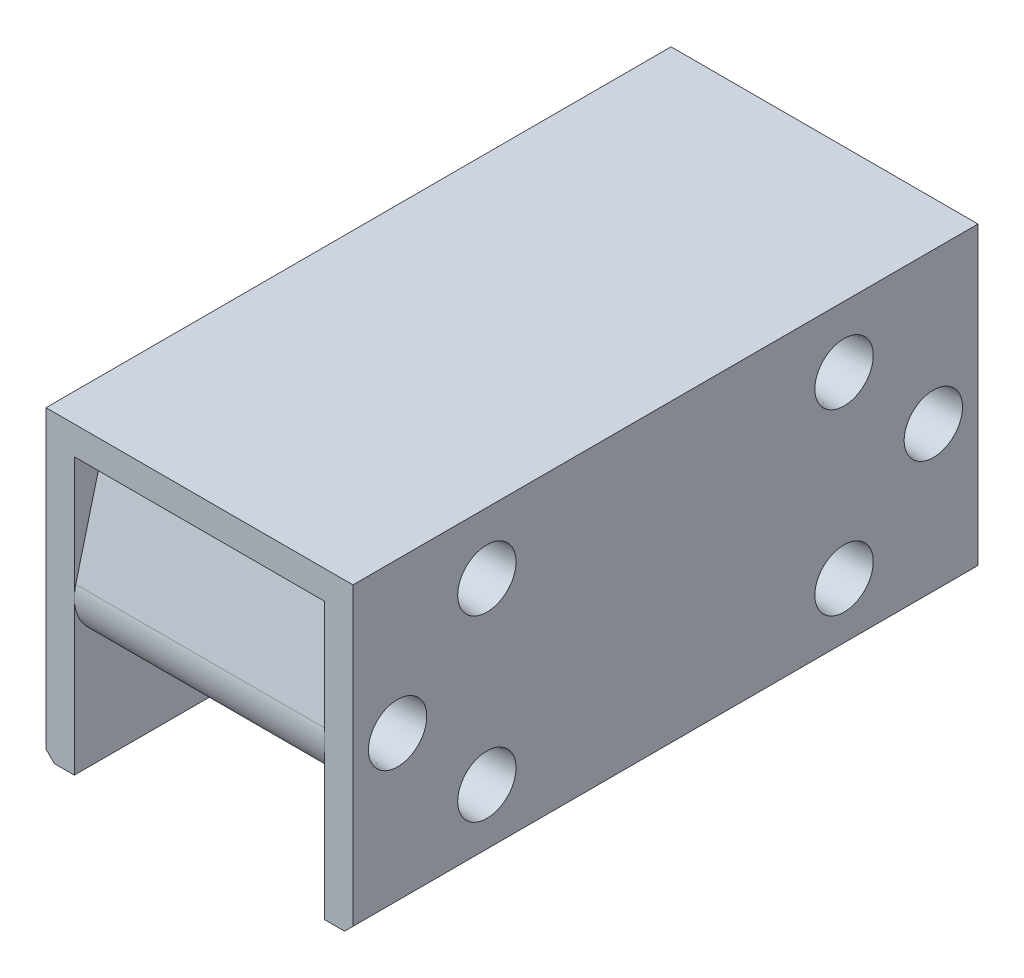
from build123d import *

# Parameters (mm, degrees)
BOSS_EXTRUDE1_DEPTH             = 12
BOSS_EXTRUDE1_DEPTH_BACK        = 44
BOSS_EXTRUDE2_REACH             = 56.729
BOSS_EXTRUDE2_DIRECTION_2_REACH = 56.729
CHAMFER1_SIZE                   = 0.75


# Read off the part's stored shape, not the designer's step: Sketch-Pattern1
with BuildPart() as part:
    # Sketch1 → Boss-Extrude1 (new, two sides: drawn at the far end of the back side and taken through both)
    with BuildSketch(Plane.XY.offset(-BOSS_EXTRUDE1_DEPTH_BACK)):
        Polygon((-13.75, 29.5), (13.75, 29.5), (13.75, 2.254), (11.21, 2.254), (11.21, 26.96), (-11.21, 26.96), (-11.21, 2.254), (-13.75, 2.254), align=None)
    extrude(amount=BOSS_EXTRUDE1_DEPTH + BOSS_EXTRUDE1_DEPTH_BACK)

    # Boss-Extrude2: up to this face of the body (flat: up to its plane)
    boss_extrude2_end = Plane(part.part.faces().sort_by_distance((13.75, 15.877, -16))[0])
    # Sketch2 → Boss-Extrude2 (add, up to the picked face)
    with BuildSketch(Plane(origin=(0, 0, 0), x_dir=(0, 0, -1), z_dir=(1, 0, 0)), mode=Mode.PRIVATE) as boss_extrude2_sk1:
        with BuildLine():
            Line((-3.872983346, 9), (-1, 20.127016654))
            ThreePointArc((-1, 20.127016654), (0, 28), (1, 20.127016654))
            Line((1, 20.127016654), (3.872983346, 9))
            ThreePointArc((3.872983346, 9), (0, 4), (-3.872983346, 9))
        make_face()
    boss_extrude2_tool1 = split(extrude(boss_extrude2_sk1.sketch, amount=BOSS_EXTRUDE2_REACH, mode=Mode.PRIVATE), bisect_by=boss_extrude2_end, keep=Keep.BOTH, mode=Mode.PRIVATE)
    # Sketch2 → Boss-Extrude2 (add, up to the picked face)
    with BuildSketch(Plane(origin=(0, 0, 0), x_dir=(0, 0, -1), z_dir=(1, 0, 0)), mode=Mode.PRIVATE) as boss_extrude2_sk2:
        with BuildLine():
            Line((-4.127016654, 17), (-6.698677596, 26.96))
            Line((-6.698677596, 26.96), (-9.301322404, 26.96))
            Line((-9.301322404, 26.96), (-11.872983346, 17))
            ThreePointArc((-11.872983346, 17), (-8, 12), (-4.127016654, 17))
        make_face()
    boss_extrude2_tool2 = split(extrude(boss_extrude2_sk2.sketch, amount=BOSS_EXTRUDE2_REACH, mode=Mode.PRIVATE), bisect_by=boss_extrude2_end, keep=Keep.BOTH, mode=Mode.PRIVATE)
    # Sketch2 → Boss-Extrude2 (add, up to the picked face)
    with BuildSketch(Plane(origin=(0, 0, 0), x_dir=(0, 0, -1), z_dir=(1, 0, 0)), mode=Mode.PRIVATE) as boss_extrude2_sk3:
        with BuildLine():
            Line((41.301322404, 26.96), (38.698677596, 26.96))
            Line((38.698677596, 26.96), (36.127016654, 17))
            ThreePointArc((36.127016654, 17), (40, 12), (43.872983346, 17))
            Line((43.872983346, 17), (41.301322404, 26.96))
        make_face()
    boss_extrude2_tool3 = split(extrude(boss_extrude2_sk3.sketch, amount=BOSS_EXTRUDE2_REACH, mode=Mode.PRIVATE), bisect_by=boss_extrude2_end, keep=Keep.BOTH, mode=Mode.PRIVATE)
    # Sketch2 → Boss-Extrude2 (add, up to the picked face)
    with BuildSketch(Plane(origin=(0, 0, 0), x_dir=(0, 0, -1), z_dir=(1, 0, 0)), mode=Mode.PRIVATE) as boss_extrude2_sk4:
        with BuildLine():
            Line((28.127016654, 9), (31, 20.127016654))
            ThreePointArc((31, 20.127016654), (32, 28), (33, 20.127016654))
            Line((33, 20.127016654), (35.872983346, 9))
            ThreePointArc((35.872983346, 9), (32, 4), (28.127016654, 9))
        make_face()
    boss_extrude2_tool4 = split(extrude(boss_extrude2_sk4.sketch, amount=BOSS_EXTRUDE2_REACH, mode=Mode.PRIVATE), bisect_by=boss_extrude2_end, keep=Keep.BOTH, mode=Mode.PRIVATE)
    add(boss_extrude2_tool1.solids().sort_by(Axis((0, 15.717101, 0), (1, 0, 0)))[0])
    add(boss_extrude2_tool2.solids().sort_by(Axis((0, 18.682958, 8), (1, 0, 0)))[0])
    add(boss_extrude2_tool3.solids().sort_by(Axis((0, 18.682958, -40), (1, 0, 0)))[0])
    add(boss_extrude2_tool4.solids().sort_by(Axis((0, 15.717101, -32), (1, 0, 0)))[0])

    # Boss-Extrude2 direction 2: up to this face of the body (flat: up to its plane)
    boss_extrude2_direction_2_end = Plane(part.part.faces().sort_by_distance((-13.75, 15.877, -16))[0])
    # Sketch2 → Boss-Extrude2 direction 2 (add, up to the picked face)
    with BuildSketch(Plane(origin=(0, 0, 0), x_dir=(0, 0, -1), z_dir=(1, 0, 0)), mode=Mode.PRIVATE) as boss_extrude2_direction_2_sk1:
        with BuildLine():
            Line((-3.872983346, 9), (-1, 20.127016654))
            ThreePointArc((-1, 20.127016654), (0, 28), (1, 20.127016654))
            Line((1, 20.127016654), (3.872983346, 9))
            ThreePointArc((3.872983346, 9), (0, 4), (-3.872983346, 9))
        make_face()
    boss_extrude2_direction_2_tool1 = split(extrude(boss_extrude2_direction_2_sk1.sketch, amount=-BOSS_EXTRUDE2_DIRECTION_2_REACH, mode=Mode.PRIVATE), bisect_by=boss_extrude2_direction_2_end, keep=Keep.BOTH, mode=Mode.PRIVATE)
    # Sketch2 → Boss-Extrude2 direction 2 (add, up to the picked face)
    with BuildSketch(Plane(origin=(0, 0, 0), x_dir=(0, 0, -1), z_dir=(1, 0, 0)), mode=Mode.PRIVATE) as boss_extrude2_direction_2_sk2:
        with BuildLine():
            Line((-4.127016654, 17), (-6.698677596, 26.96))
            Line((-6.698677596, 26.96), (-9.301322404, 26.96))
            Line((-9.301322404, 26.96), (-11.872983346, 17))
            ThreePointArc((-11.872983346, 17), (-8, 12), (-4.127016654, 17))
        make_face()
    boss_extrude2_direction_2_tool2 = split(extrude(boss_extrude2_direction_2_sk2.sketch, amount=-BOSS_EXTRUDE2_DIRECTION_2_REACH, mode=Mode.PRIVATE), bisect_by=boss_extrude2_direction_2_end, keep=Keep.BOTH, mode=Mode.PRIVATE)
    # Sketch2 → Boss-Extrude2 direction 2 (add, up to the picked face)
    with BuildSketch(Plane(origin=(0, 0, 0), x_dir=(0, 0, -1), z_dir=(1, 0, 0)), mode=Mode.PRIVATE) as boss_extrude2_direction_2_sk3:
        with BuildLine():
            Line((41.301322404, 26.96), (38.698677596, 26.96))
            Line((38.698677596, 26.96), (36.127016654, 17))
            ThreePointArc((36.127016654, 17), (40, 12), (43.872983346, 17))
            Line((43.872983346, 17), (41.301322404, 26.96))
        make_face()
    boss_extrude2_direction_2_tool3 = split(extrude(boss_extrude2_direction_2_sk3.sketch, amount=-BOSS_EXTRUDE2_DIRECTION_2_REACH, mode=Mode.PRIVATE), bisect_by=boss_extrude2_direction_2_end, keep=Keep.BOTH, mode=Mode.PRIVATE)
    # Sketch2 → Boss-Extrude2 direction 2 (add, up to the picked face)
    with BuildSketch(Plane(origin=(0, 0, 0), x_dir=(0, 0, -1), z_dir=(1, 0, 0)), mode=Mode.PRIVATE) as boss_extrude2_direction_2_sk4:
        with BuildLine():
            Line((28.127016654, 9), (31, 20.127016654))
            ThreePointArc((31, 20.127016654), (32, 28), (33, 20.127016654))
            Line((33, 20.127016654), (35.872983346, 9))
            ThreePointArc((35.872983346, 9), (32, 4), (28.127016654, 9))
        make_face()
    boss_extrude2_direction_2_tool4 = split(extrude(boss_extrude2_direction_2_sk4.sketch, amount=-BOSS_EXTRUDE2_DIRECTION_2_REACH, mode=Mode.PRIVATE), bisect_by=boss_extrude2_direction_2_end, keep=Keep.BOTH, mode=Mode.PRIVATE)
    add(boss_extrude2_direction_2_tool1.solids().sort_by(Axis((0, 15.717101, 0), (-1, 0, 0)))[0])
    add(boss_extrude2_direction_2_tool2.solids().sort_by(Axis((0, 18.682958, 8), (-1, 0, 0)))[0])
    add(boss_extrude2_direction_2_tool3.solids().sort_by(Axis((0, 18.682958, -40), (-1, 0, 0)))[0])
    add(boss_extrude2_direction_2_tool4.solids().sort_by(Axis((0, 15.717101, -32), (-1, 0, 0)))[0])


with BuildPart() as body_2:
    # Sketch5 → Revolve1 (revolve)
    with BuildSketch(Plane.XY.offset(8), mode=Mode.PRIVATE) as revolve1_sk:
        Polygon((6.13, 17.905), (6.13, 18.3495), (9.936012309, 18.3495), (13.75, 18.6162), (13.75, 16), (-13.75, 16), (-13.75, 18.6162), (-9.936012309, 18.3495), (-6.13, 18.3495), (-6.13, 17.905), align=None)
    revolve(revolve1_sk.sketch.rotate(Axis((0, 16, 8), (1, 0, 0)), 90), axis=Axis((0, 16, 8), (1, 0, 0)))


with BuildPart() as body_3:
    # Sketch-Pattern1 outline → Sketch-Pattern1 (revolve)
    with BuildSketch(Plane(origin=(0, 16, -40), x_dir=(0, 1, 0), z_dir=(0, 0, -1))):
        Polygon((0, 13.75), (0, -13.75), (2.6162, -13.75), (2.3495, -9.936012309), (2.3495, -6.13), (1.905, -6.13), (1.905, 6.13), (2.3495, 6.13), (2.3495, 9.936012309), (2.6162, 13.75), align=None)
    revolve(axis=Axis((0, 16, -40), (1, 0, 0)))


with BuildPart() as body_4:
    # Sketch-Pattern1 2 outline → Sketch-Pattern1 2 (revolve)
    with BuildSketch(Plane(origin=(0, 8, -32), x_dir=(0, 1, 0), z_dir=(0, 0, -1))):
        Polygon((0, 13.75), (0, -13.75), (2.6162, -13.75), (2.3495, -9.936012309), (2.3495, -6.13), (1.905, -6.13), (1.905, 6.13), (2.3495, 6.13), (2.3495, 9.936012309), (2.6162, 13.75), align=None)
    revolve(axis=Axis((0, 8, -32), (1, 0, 0)))


with BuildPart() as body_5:
    # Sketch-Pattern1 3 outline → Sketch-Pattern1 3 (revolve)
    with BuildSketch(Plane(origin=(0, 24, -32), x_dir=(0, 1, 0), z_dir=(0, 0, -1))):
        Polygon((0, 13.75), (0, -13.75), (2.6162, -13.75), (2.3495, -9.936012309), (2.3495, -6.13), (1.905, -6.13), (1.905, 6.13), (2.3495, 6.13), (2.3495, 9.936012309), (2.6162, 13.75), align=None)
    revolve(axis=Axis((0, 24, -32), (1, 0, 0)))


with BuildPart() as body_6:
    # Sketch-Pattern1 4 outline → Sketch-Pattern1 4 (revolve)
    with BuildSketch(Plane(origin=(0, 8, 0), x_dir=(0, 1, 0), z_dir=(0, 0, -1))):
        Polygon((0, 13.75), (0, -13.75), (2.6162, -13.75), (2.3495, -9.936012309), (2.3495, -6.13), (1.905, -6.13), (1.905, 6.13), (2.3495, 6.13), (2.3495, 9.936012309), (2.6162, 13.75), align=None)
    revolve(axis=Axis((0, 8, 0), (1, 0, 0)))


with BuildPart() as body_7:
    # Sketch-Pattern1 5 outline → Sketch-Pattern1 5 (revolve)
    with BuildSketch(Plane(origin=(0, 24, 0), x_dir=(0, 1, 0), z_dir=(0, 0, -1))):
        Polygon((0, 13.75), (0, -13.75), (2.6162, -13.75), (2.3495, -9.936012309), (2.3495, -6.13), (1.905, -6.13), (1.905, 6.13), (2.3495, 6.13), (2.3495, 9.936012309), (2.6162, 13.75), align=None)
    revolve(axis=Axis((0, 24, 0), (1, 0, 0)))


with BuildPart() as part_1:
    add(part.part)

    # Combine1: cut body 2, body 7, body 6, body 5, body 4, body 3
    add(body_2.part, mode=Mode.SUBTRACT)
    add(body_7.part, mode=Mode.SUBTRACT)
    add(body_6.part, mode=Mode.SUBTRACT)
    add(body_5.part, mode=Mode.SUBTRACT)
    add(body_4.part, mode=Mode.SUBTRACT)
    add(body_3.part, mode=Mode.SUBTRACT)

    # Chamfer1
    chamfer1_edges = [part_1.edges().sort_by_distance(p)[0] for p in [
        (-13.75, 2.254, -16),
        (13.75, 2.254, -16),
    ]]
    chamfer(chamfer1_edges, length=CHAMFER1_SIZE)


solid = part_1.part
